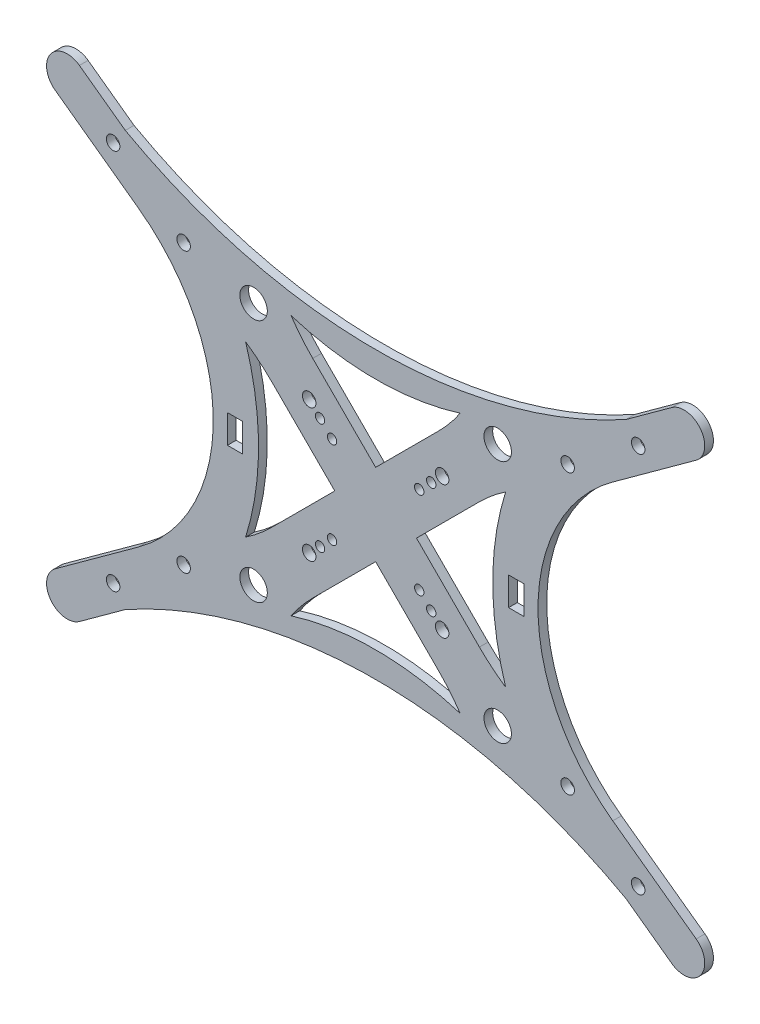
from build123d import *

# Parameters (mm, degrees)
SKETCH_7_R          = 1.075
SKETCH_7_R_2        = 1.55
SKETCH_7_R_3        = 3.15
SKETCH_7_R_4        = 3.150000003
EXTRUDE_1_DEPTH     = 2
CUT_EXTRUDE_2_DEPTH = 95.101973737
SKETCH_8_W          = 3.5
SKETCH_8_H          = 6.5
CUT_EXTRUDE_3_DEPTH = 95.101973737


with BuildPart() as part:
    # 草图7 → 凸台-拉伸1 (new body)
    with BuildSketch(Plane.XY):
        with BuildLine():
            Line((-67.948496874, -55.238795586), (-57.42060576, -47.589834961))
            ThreePointArc((-57.42060576, -47.589834961), (0, -32.757979874), (57.42060576, -47.589834961))
            Line((57.42060576, -47.589834961), (67.948496874, -55.238795586))
            ThreePointArc((67.948496874, -55.238795586), (74.583307546, -54.187944811), (73.532456771, -47.55313414))
            Line((73.532456771, -47.55313414), (54.395000648, -33.648958388))
            ThreePointArc((54.395000648, -33.648958388), (37.25, 0), (54.395000648, 33.648958388))
            Line((54.395000648, 33.648958388), (73.532456771, 47.55313414))
            ThreePointArc((73.532456771, 47.55313414), (74.583307546, 54.187944811), (67.948496874, 55.238795586))
            Line((67.948496874, 55.238795586), (57.42060576, 47.589834961))
            ThreePointArc((57.42060576, 47.589834961), (0, 32.757979874), (-57.42060576, 47.589834961))
            Line((-57.42060576, 47.589834961), (-67.948496874, 55.238795586))
            ThreePointArc((-67.948496874, 55.238795586), (-74.583307546, 54.187944811), (-73.532456771, 47.55313414))
            Line((-73.532456771, 47.55313414), (-54.395000648, 33.648958388))
            ThreePointArc((-54.395000648, 33.648958388), (-37.25, 0), (-54.395000648, -33.648958388))
            Line((-54.395000648, -33.648958388), (-73.532456771, -47.55313414))
            ThreePointArc((-73.532456771, -47.55313414), (-74.583307546, -54.187944811), (-67.948496874, -55.238795586))
        make_face()
        with Locations((10, 10)):
            Circle(SKETCH_7_R, mode=Mode.SUBTRACT)
        with Locations((12.75, 12.75)):
            Circle(SKETCH_7_R, mode=Mode.SUBTRACT)
        with Locations((15.25, 15.25)):
            Circle(SKETCH_7_R_2, mode=Mode.SUBTRACT)
        with Locations((15.25, -15.25)):
            Circle(SKETCH_7_R_2, mode=Mode.SUBTRACT)
        with Locations((12.75, -12.75)):
            Circle(SKETCH_7_R, mode=Mode.SUBTRACT)
        with Locations((10, -10)):
            Circle(SKETCH_7_R, mode=Mode.SUBTRACT)
        with Locations((28, -28)):
            Circle(SKETCH_7_R_3, mode=Mode.SUBTRACT)
        with Locations((28, 28)):
            Circle(SKETCH_7_R_4, mode=Mode.SUBTRACT)
        with Locations((60.224561343, 43.755705046)):
            Circle(SKETCH_7_R_2, mode=Mode.SUBTRACT)
        with Locations((-60.224561343, 43.755705046)):
            Circle(SKETCH_7_R_2, mode=Mode.SUBTRACT)
        with Locations((-28, 28)):
            Circle(SKETCH_7_R_4, mode=Mode.SUBTRACT)
        with Locations((-28, -28)):
            Circle(SKETCH_7_R_3, mode=Mode.SUBTRACT)
        with Locations((-10, -10)):
            Circle(SKETCH_7_R, mode=Mode.SUBTRACT)
        with Locations((-12.75, -12.75)):
            Circle(SKETCH_7_R, mode=Mode.SUBTRACT)
        with Locations((-15.25, -15.25)):
            Circle(SKETCH_7_R_2, mode=Mode.SUBTRACT)
        with Locations((-15.25, 15.25)):
            Circle(SKETCH_7_R_2, mode=Mode.SUBTRACT)
        with Locations((-12.75, 12.75)):
            Circle(SKETCH_7_R, mode=Mode.SUBTRACT)
        with Locations((-10, 10)):
            Circle(SKETCH_7_R, mode=Mode.SUBTRACT)
        with Locations((60.224561343, -43.755705046)):
            Circle(SKETCH_7_R_2, mode=Mode.SUBTRACT)
        with Locations((44.044221455, -32)):
            Circle(SKETCH_7_R_2, mode=Mode.SUBTRACT)
        with Locations((44.044221455, 32)):
            Circle(SKETCH_7_R_2, mode=Mode.SUBTRACT)
        with Locations((-44.044221455, 32)):
            Circle(SKETCH_7_R_2, mode=Mode.SUBTRACT)
        with Locations((-60.224561343, -43.755705046)):
            Circle(SKETCH_7_R_2, mode=Mode.SUBTRACT)
        with Locations((-44.044221455, -32)):
            Circle(SKETCH_7_R_2, mode=Mode.SUBTRACT)
    extrude(amount=EXTRUDE_1_DEPTH)

    # 草图6 → 切除-拉伸2 (cut, through all)
    with BuildSketch(Plane.XY):
        with BuildLine():
            Line((-23.801448899, 14.429581723), (-9.371867176, 0))
            Line((-9.371867176, 0), (-23.801448899, -14.429581723))
            ThreePointArc((-23.801448899, -14.429581723), (-26.692624222, -17.058284994), (-29.820182402, -19.400795498))
            ThreePointArc((-29.820182402, -19.400795498), (-26.863678166, 0), (-29.820182402, 19.400795498))
            ThreePointArc((-29.820182402, 19.400795498), (-26.692624222, 17.058284994), (-23.801448899, 14.429581723))
        make_face()
        with BuildLine():
            Line((14.429581723, 23.801448899), (0, 9.371867176))
            Line((0, 9.371867176), (-14.429581723, 23.801448899))
            ThreePointArc((-14.429581723, 23.801448899), (-17.058284994, 26.692624222), (-19.400795498, 29.820182402))
            ThreePointArc((-19.400795498, 29.820182402), (0, 26.863678166), (19.400795498, 29.820182402))
            ThreePointArc((19.400795498, 29.820182402), (17.058284994, 26.692624222), (14.429581723, 23.801448899))
        make_face()
        with BuildLine():
            Line((23.801448899, -14.429581723), (9.371867176, 0))
            Line((9.371867176, 0), (23.801448899, 14.429581723))
            ThreePointArc((23.801448899, 14.429581723), (26.692624222, 17.058284994), (29.820182402, 19.400795498))
            ThreePointArc((29.820182402, 19.400795498), (26.863678166, 0), (29.820182402, -19.400795498))
            ThreePointArc((29.820182402, -19.400795498), (26.692624222, -17.058284994), (23.801448899, -14.429581723))
        make_face()
        with BuildLine():
            Line((-14.429581723, -23.801448899), (0, -9.371867176))
            Line((0, -9.371867176), (14.429581723, -23.801448899))
            ThreePointArc((14.429581723, -23.801448899), (17.058284994, -26.692624222), (19.400795498, -29.820182402))
            ThreePointArc((19.400795498, -29.820182402), (0, -26.863678166), (-19.400795498, -29.820182402))
            ThreePointArc((-19.400795498, -29.820182402), (-17.058284994, -26.692624222), (-14.429581723, -23.801448899))
        make_face()
    extrude(amount=CUT_EXTRUDE_2_DEPTH, mode=Mode.SUBTRACT)

    # 草图8 → 切除-拉伸3 (cut, through all)
    with BuildSketch(Plane.XY):
        with Locations((32.25, 0)):
            Rectangle(SKETCH_8_W, SKETCH_8_H)
        with Locations((-32.25, 0)):
            Rectangle(SKETCH_8_W, SKETCH_8_H)
    extrude(amount=CUT_EXTRUDE_3_DEPTH, mode=Mode.SUBTRACT)


solid = part.part
